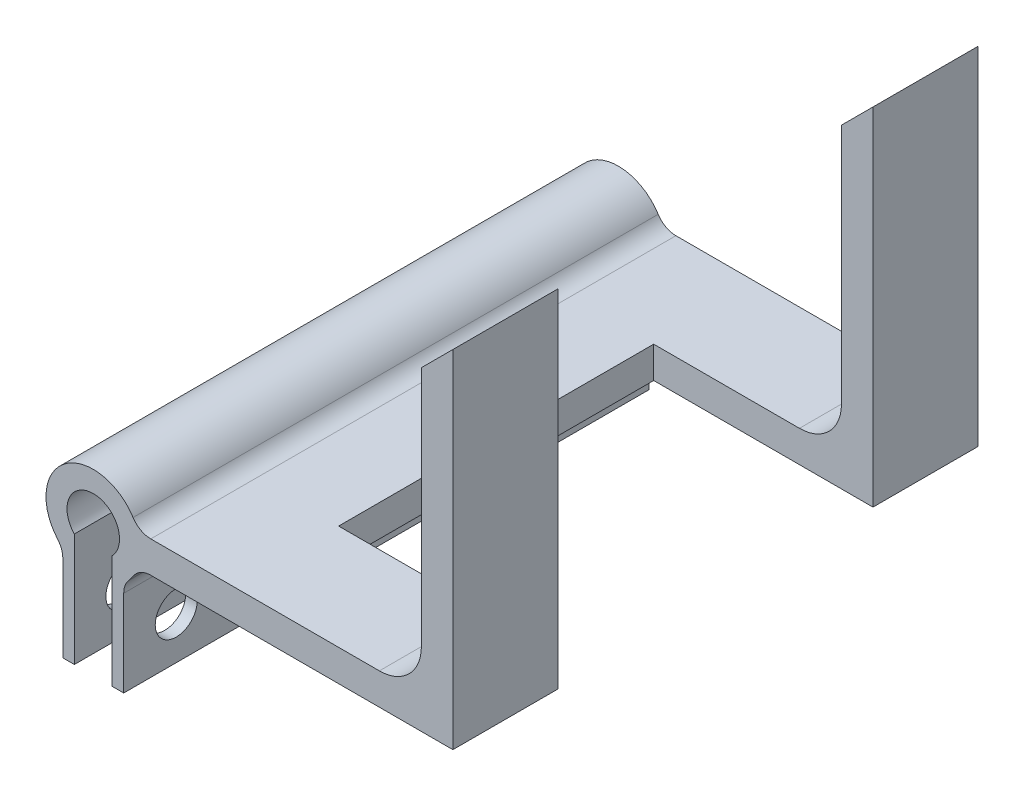
from build123d import *

# Parameters (mm, degrees)
SKETCH_1_R          = 2.25
SKETCH_1_R_2        = 1.25
EXTRUDE_1_DEPTH     = 25
EXTRUDE_START       = -25
EXTRUDE_2_DEPTH     = 25
CUT_EXTRUDE_1_DEPTH = 25
SKETCH_4_W          = 0.55
SKETCH_4_H          = 25
EXTRUDE_3_DEPTH     = 2
EXTRUDE_4_DEPTH     = 25
FILLET_1_R          = 1
SKETCH_6_W          = 1.5
SKETCH_6_H          = 25
EXTRUDE_6_DEPTH     = 15
SKETCH_7_W          = 17.879358453
SKETCH_7_H          = 15
CUT_EXTRUDE_2_DEPTH = 50
FILLET_2_R          = 2
SKETCH_8_R          = 1
CUT_EXTRUDE_3_DEPTH = 10
CHAMFER_1_SIZE      = 1.5


with BuildPart() as part:
    # 草图1 → 凸台-拉伸1 (new body)
    with BuildSketch(Plane.XY):
        Circle(SKETCH_1_R)
        Circle(SKETCH_1_R_2, mode=Mode.SUBTRACT)
    extrude(amount=EXTRUDE_1_DEPTH)

    # 草图2 → 凸台-拉伸2 (add)
    with BuildSketch(Plane.XY.offset(25).offset(EXTRUDE_START)):
        with BuildLine():
            Line((-0.9, -4.25), (-0.9, -2.062159063))
            ThreePointArc((-0.9, -2.062159063), (-1.187355759, -1.911200225), (-1.45, -1.720465053))
            Line((-1.45, -1.720465053), (-1.45, -4.25))
            Line((-1.45, -4.25), (-0.9, -4.25))
        make_face()
        with BuildLine():
            ThreePointArc((1.45, -1.720465053), (1.187355759, -1.911200225), (0.9, -2.062159063))
            Line((0.9, -2.062159063), (0.9, -4.25))
            Line((0.9, -4.25), (1.45, -4.25))
            Line((1.45, -4.25), (1.45, -1.720465053))
        make_face()
    extrude(amount=EXTRUDE_2_DEPTH)

    # 草图3 → 切除-拉伸1 (cut)
    with BuildSketch(Plane.XY.offset(25)):
        Polygon((-0.9, -2.062159063), (-0.9, -0.608172981), (0.9, -0.572608175), (0.9, -2.062159063), (-0.22034315, -2.711539451), align=None)
    extrude(amount=-CUT_EXTRUDE_1_DEPTH, mode=Mode.SUBTRACT)

    # 草图4 → 凸台-拉伸3 (add)
    with BuildSketch(Plane.XZ.offset(4.25)):
        with Locations((1.175, 12.5)):
            Rectangle(SKETCH_4_W, SKETCH_4_H)
        with Locations((-1.175, 12.5)):
            Rectangle(SKETCH_4_W, SKETCH_4_H)
    extrude(amount=EXTRUDE_3_DEPTH)

    # 草图5 → 凸台-拉伸4 (add)
    with BuildSketch(Plane.XY.offset(25).offset(EXTRUDE_START)):
        with BuildLine():
            Line((2.121320344, 0.75), (17.121320344, 0.75))
            Line((17.121320344, 0.75), (17.121320344, -0.75))
            Line((17.121320344, -0.75), (2.121320344, -0.75))
            ThreePointArc((2.121320344, -0.75), (2.25, 0), (2.121320344, 0.75))
        make_face()
    extrude(amount=EXTRUDE_4_DEPTH)

    # 圆角1
    fillet_1_edges = [part.edges().sort_by_distance(p)[0] for p in [
        (-1.45, -1.720465053, 12.5),
        (1.45, -1.720465053, 12.5),
        (2.121320344, -0.75, 12.5),
        (2.121320344, 0.75, 12.5),
    ]]
    fillet(fillet_1_edges, radius=FILLET_1_R)

    # 草图6 → 凸台-拉伸6 (add)
    with BuildSketch(Plane(origin=(0, 0.75, 0), x_dir=(1, 0, 0), z_dir=(0, 1, 0))):
        with Locations((16.371320344, -12.5)):
            Rectangle(SKETCH_6_W, SKETCH_6_H)
    extrude(amount=EXTRUDE_6_DEPTH)

    # 草图7 → 切除-拉伸2 (cut, symmetric)
    with BuildSketch(Plane(origin=(0, 0.75, 0), x_dir=(1, 0, 0), z_dir=(0, 1, 0))):
        with Locations((15.621320344, -12.5)):
            Rectangle(SKETCH_7_W, SKETCH_7_H)
    extrude(amount=CUT_EXTRUDE_2_DEPTH, both=True, mode=Mode.SUBTRACT)

    # 圆角2
    fillet_2_edges = [part.edges().sort_by_distance(p)[0] for p in [
        (15.621320344, 0.75, 2.5),
        (15.621320344, 0.75, 22.5),
    ]]
    fillet(fillet_2_edges, radius=FILLET_2_R)

    # 草图8 → 切除-拉伸3 (cut)
    with BuildSketch(Plane.ZY.offset(1.45)):
        with Locations((2.5, -4.192707825)):
            Circle(SKETCH_8_R)
        with Locations((22.5, -4.192707825)):
            Circle(SKETCH_8_R)
    extrude(amount=-CUT_EXTRUDE_3_DEPTH, mode=Mode.SUBTRACT)

    # 倒角1
    chamfer_1_edges = [part.edges().sort_by_distance(p)[0] for p in [
        (15.621320344, 15.75, 2.5),
        (15.621320344, 15.75, 22.5),
    ]]
    chamfer(chamfer_1_edges, length=CHAMFER_1_SIZE - 0.0001)  # a hair under: the kernel refuses the full size


solid = part.part
